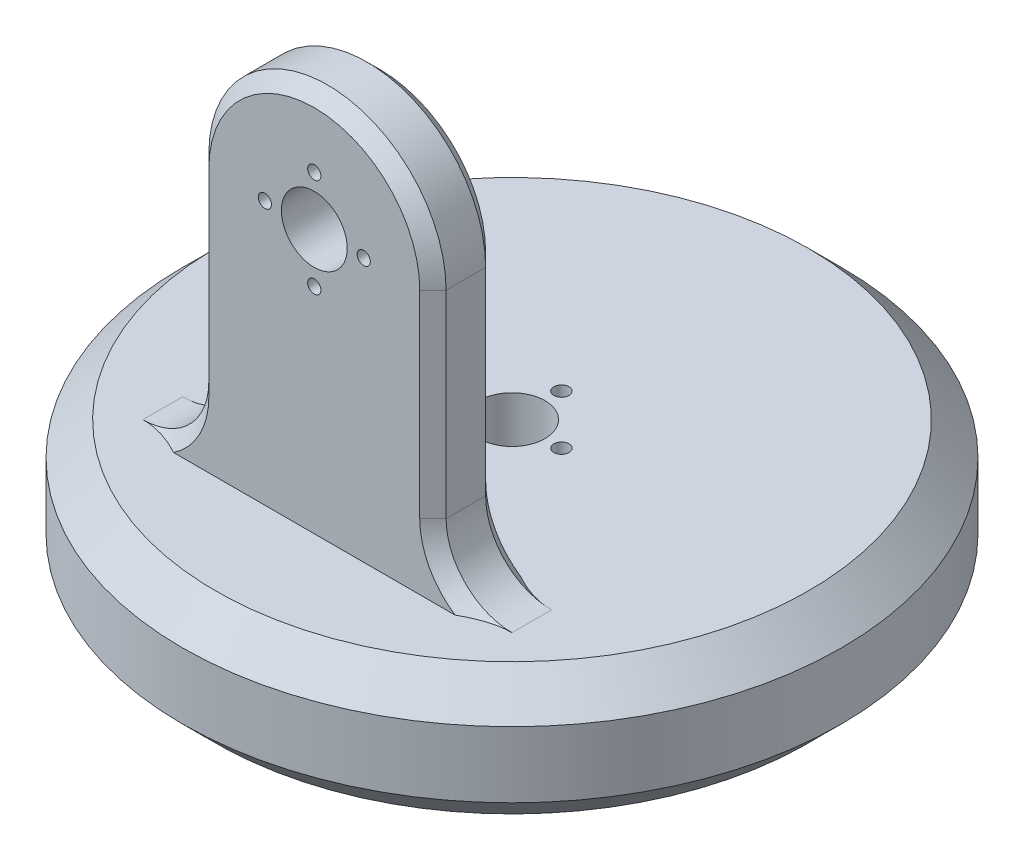
from build123d import *

# Parameters (mm, degrees)
SKETCH2_R           = 1.15
SKETCH2_R_2         = 5
CUT_EXTRUDE1_DEPTH  = 74.484692283
BOSS_EXTRUDE1_START = 20
SKETCH6_R           = 5
SKETCH6_R_2         = 1
BOSS_EXTRUDE1_DEPTH = 10
FILLET1_R           = 10
CHAMFER1_SIZE       = 2


with BuildPart() as part:
    # Sketch1 → Revolve1 (revolve)
    with BuildSketch(Plane.XY, mode=Mode.PRIVATE) as revolve1_sk:
        Polygon((45, 0), (50, 5), (50, 15), (45, 20), (5, 20), (5, 0), align=None)
        Polygon((9, 2), (44.171572875, 2), (48, 5.828427125), (48, 14.171572875), (44.171572875, 18), (9, 18), align=None, mode=Mode.SUBTRACT)
    revolve(revolve1_sk.sketch.rotate(Axis((0, -3.9, 0), (0, 1, 0)), 90), axis=Axis((0, -3.9, 0), (0, 1, 0)))

    # Sketch2 → Cut-Extrude1 (cut, through all)
    with BuildSketch(Plane.XZ):
        with Locations(Location((7.5, 0, 0), (0, 0, 270))):
            Circle(SKETCH2_R)
        with Locations(Location((0, 7.5, 0), (0, 0, 270))):
            Circle(SKETCH2_R)
        with Locations(Location((-7.5, 0, 0), (0, 0, 270))):
            Circle(SKETCH2_R)
        with Locations(Location((0, -7.5, 0), (0, 0, 270))):
            Circle(SKETCH2_R)
        with Locations(Location((0, 0, 0), (0, 0, 270))):
            Circle(SKETCH2_R_2)
    extrude(amount=-CUT_EXTRUDE1_DEPTH, mode=Mode.SUBTRACT)

    # Sketch6 → Boss-Extrude1 (add)
    with BuildSketch(Plane.XY.offset(BOSS_EXTRUDE1_START)):
        with BuildLine():
            Line((18, 60), (18, 20))
            Line((18, 20), (-18, 20))
            Line((-18, 20), (-18, 60))
            ThreePointArc((-18, 60), (0, 78), (18, 60))
        make_face()
        with Locations((0, 60)):
            Circle(SKETCH6_R, mode=Mode.SUBTRACT)
        with Locations((0, 52.5)):
            Circle(SKETCH6_R_2, mode=Mode.SUBTRACT)
        with Locations((7.5, 60)):
            Circle(SKETCH6_R_2, mode=Mode.SUBTRACT)
        with Locations((0, 67.5)):
            Circle(SKETCH6_R_2, mode=Mode.SUBTRACT)
        with Locations((-7.5, 60)):
            Circle(SKETCH6_R_2, mode=Mode.SUBTRACT)
    extrude(amount=BOSS_EXTRUDE1_DEPTH)

    # Fillet1
    fillet1_edges = [part.edges().sort_by_distance(p)[0] for p in [
        (-18, 20, 25),
        (18, 20, 25),
    ]]
    fillet(fillet1_edges, radius=FILLET1_R)

    # Chamfer1
    # the kernel refuses this chamfer: 2 mm, written as the material it takes off along each edge
    with BuildSketch(Plane(origin=(0, 60, 30), x_dir=(-1, 0, 0), z_dir=(0, -1, 0))) as chamfer1_piece_1:
        Polygon((18, CHAMFER1_SIZE), (18 - CHAMFER1_SIZE, 0), (18, 0), align=None)
    revolve(axis=Axis((0, 60, 30), (0, 0, -1)), revolution_arc=180, mode=Mode.SUBTRACT)
    with BuildSketch(Plane(origin=(-18, 30, 30), x_dir=(-0.027495876610585647, 0, -0.9996219169112968), z_dir=(0, 1, 0)), Plane(origin=(18, 60, 30), x_dir=(0.027495876610585647, 0, -0.9996219169112968), z_dir=(0, -1, 0))) as chamfer1_piece_2:
        Polygon((CHAMFER1_SIZE * 0.999621916911, -CHAMFER1_SIZE * 0.0274958766106), (-CHAMFER1_SIZE * 0.0274958766106, -CHAMFER1_SIZE * 0.999621916911), (0, 0), align=None)
    extrude(amount=30, mode=Mode.SUBTRACT)
    with BuildSketch(Plane(origin=(0, 60, 20), x_dir=(-1, 0, 0), z_dir=(0, -1, 0))) as chamfer1_piece_3:
        Polygon((18, -CHAMFER1_SIZE), (18 - CHAMFER1_SIZE, 0), (18, 0), align=None)
    revolve(axis=Axis((0, 60, 20), (0, 0, -1)), revolution_arc=180, mode=Mode.SUBTRACT)
    with BuildSketch(Plane(origin=(-18, 30, 20), x_dir=(-0.027495876610585647, 0, 0.9996219169112968), z_dir=(0, 1, 0)), Plane(origin=(18, 60, 20), x_dir=(0.027495876610585647, 0, 0.9996219169112968), z_dir=(0, -1, 0))) as chamfer1_piece_4:
        Polygon((CHAMFER1_SIZE * 0.999621916911, CHAMFER1_SIZE * 0.0274958766106), (-CHAMFER1_SIZE * 0.0274958766106, CHAMFER1_SIZE * 0.999621916911), (0, 0), align=None)
    extrude(amount=30, mode=Mode.SUBTRACT)
    with BuildSketch(Plane(origin=(-28, 30, 20), x_dir=(-0.49213725734726604, -0.8705176160944192, 0), z_dir=(-0.8705176160944192, 0.49213725734726604, 0))) as chamfer1_piece_5_section:
        Polygon((10, CHAMFER1_SIZE), (10 + CHAMFER1_SIZE, 0), (10, 0), align=None)
    chamfer1_piece_5 = revolve(axis=Axis((-28, 30, 20), (0, 0, 1)), revolution_arc=119.481154356, mode=Mode.PRIVATE)
    chamfer1_piece_5 = split(chamfer1_piece_5, bisect_by=Plane(origin=(-20.846294556, 20, 20.72247208), z_dir=(0, 1, 0)), keep=Keep.TOP, mode=Mode.PRIVATE)
    add(chamfer1_piece_5, mode=Mode.SUBTRACT)
    with BuildSketch(Plane(origin=(-28, 30, 30), x_dir=(-0.49213725734726604, -0.8705176160944192, 0), z_dir=(-0.8705176160944192, 0.49213725734726604, 0))) as chamfer1_piece_6_section:
        Polygon((10, -CHAMFER1_SIZE), (10 + CHAMFER1_SIZE, 0), (10, 0), align=None)
    chamfer1_piece_6 = revolve(axis=Axis((-28, 30, 30), (0, 0, 1)), revolution_arc=119.481154356, mode=Mode.PRIVATE)
    chamfer1_piece_6 = split(chamfer1_piece_6, bisect_by=Plane(origin=(-20.846294556, 20, 29.27752792), z_dir=(0, 1, 0)), keep=Keep.TOP, mode=Mode.PRIVATE)
    add(chamfer1_piece_6, mode=Mode.SUBTRACT)
    with BuildSketch(Plane(origin=(28, 30, 20), x_dir=(0.49213725734726604, -0.8705176160944192, 0), z_dir=(0.8705176160944192, 0.49213725734726604, 0))) as chamfer1_piece_7_section:
        Polygon((10, -CHAMFER1_SIZE), (10 + CHAMFER1_SIZE, 0), (10, 0), align=None)
    chamfer1_piece_7 = revolve(axis=Axis((28, 30, 20), (0, 0, -1)), revolution_arc=119.481154356, mode=Mode.PRIVATE)
    chamfer1_piece_7 = split(chamfer1_piece_7, bisect_by=Plane(origin=(20.846294556, 20, 20.72247208), z_dir=(0, 1, 0)), keep=Keep.TOP, mode=Mode.PRIVATE)
    add(chamfer1_piece_7, mode=Mode.SUBTRACT)
    with BuildSketch(Plane(origin=(28, 30, 30), x_dir=(0.49213725734726604, -0.8705176160944192, 0), z_dir=(0.8705176160944192, 0.49213725734726604, 0))) as chamfer1_piece_8_section:
        Polygon((10 + CHAMFER1_SIZE, 0), (10, CHAMFER1_SIZE), (10, 0), align=None)
    chamfer1_piece_8 = revolve(axis=Axis((28, 30, 30), (0, 0, -1)), revolution_arc=119.481154356, mode=Mode.PRIVATE)
    chamfer1_piece_8 = split(chamfer1_piece_8, bisect_by=Plane(origin=(20.846294556, 20, 29.27752792), z_dir=(0, 1, 0)), keep=Keep.TOP, mode=Mode.PRIVATE)
    add(chamfer1_piece_8, mode=Mode.SUBTRACT)


solid = part.part
